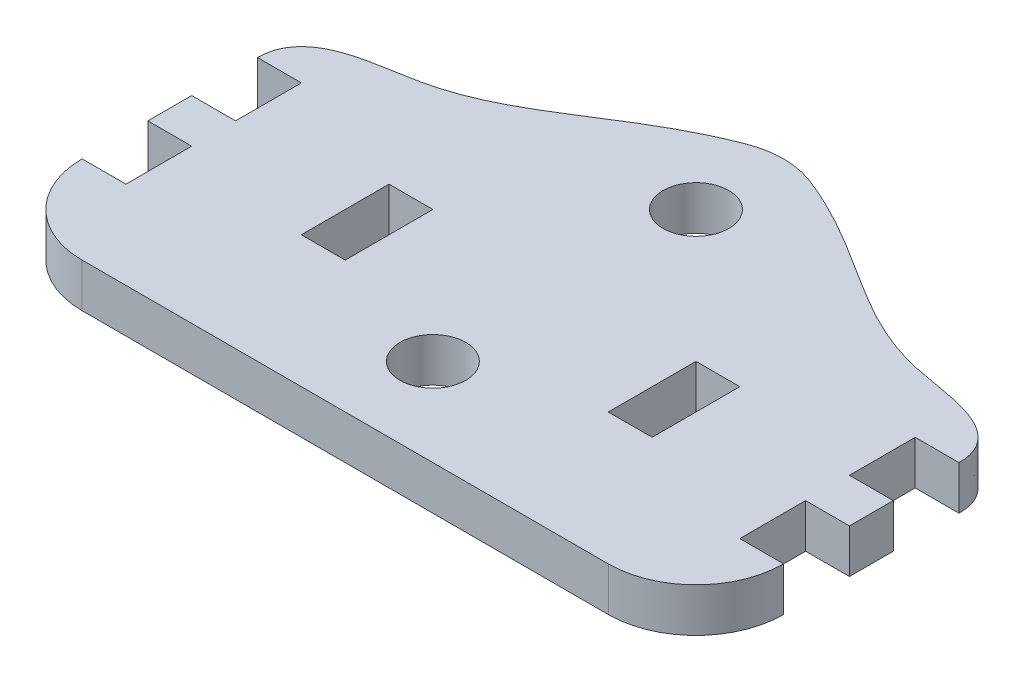
from build123d import *

# Parameters (mm, degrees)
SKETCH1_R           = 2.38125
BOSS_EXTRUDE1_DEPTH = 3.175
CAVITY1_START       = -9.525
CAVITY1_OUTLINE_W   = 3.175
CAVITY1_OUTLINE_H   = 3.175
CAVITY1_DEPTH       = 6.35


# Read off the part's stored shape, not the designer's step: Cavity1
with BuildPart() as part:
    # Sketch1 → Boss-Extrude1 (new body)
    # profile 1 of 4: a face of its own
    with BuildSketch(Plane(origin=(0, 0, 0), x_dir=(1, 0, 0), z_dir=(0, 1, 0))):
        with BuildLine():
            Line((-19.05, -6.35), (19.05, -6.35))
            ThreePointArc((19.05, -6.35), (23.540128061, -4.490128061), (25.4, 0))
            Line((25.4, 0), (22.225, 0))
            Line((22.225, 0), (22.225, 4.7625))
            Line((22.225, 4.7625), (25.4, 4.7625))
            Line((25.4, 4.7625), (25.4, 7.9375))
            Line((25.4, 7.9375), (22.225, 7.9375))
            Line((22.225, 7.9375), (22.225, 12.7))
            Line((22.225, 12.7), (0, 12.7))
            Line((0, 12.7), (-22.225, 12.7))
            Line((-22.225, 12.7), (-22.225, 7.9375))
            Line((-22.225, 7.9375), (-25.4, 7.9375))
            Line((-25.4, 7.9375), (-25.4, 4.7625))
            Line((-25.4, 4.7625), (-22.225, 4.7625))
            Line((-22.225, 4.7625), (-22.225, 0))
            Line((-22.225, 0), (-25.4, 0))
            ThreePointArc((-25.4, 0), (-23.540128061, -4.490128061), (-19.05, -6.35))
        make_face()
        with BuildLine():
            ThreePointArc((0, 2.38125), (1.683798023, 1.683798023), (2.38125, 0))
            ThreePointArc((2.38125, 0), (-1.683798023, -1.683798023), (0, 2.38125))
        make_face(mode=Mode.SUBTRACT)
    # profile 2 of 4: a face of its own
    with BuildSketch(Plane(origin=(0, 0, 0), x_dir=(1, 0, 0), z_dir=(0, 1, 0))):
        with BuildLine():
            Line((0, 12.7), (22.225, 12.7))
            Line((22.225, 12.7), (25.4, 12.7))
            add(Edge.make_bspline(
                [(25.4, 12.7), (25.4, 13.75902599), (23.890330765, 16.528390246), (16.188410672, 16.612194154), (9.505907267, 21.233154333), (4.692379923, 24.046890427), (2.283434696, 24.975236366)],
                knots=[0, 0, 0, 0, 0.091573424, 0.361911299, 0.725975428, 1, 1, 1, 1], degree=3))
            ThreePointArc((2.283434696, 24.975236366), (5.235566365, 22.643235984), (6.35, 19.05))
            ThreePointArc((6.35, 19.05), (4.490128061, 14.559871939), (0, 12.7))
        make_face()
    # profile 3 of 4: a face of its own
    with BuildSketch(Plane(origin=(0, 0, 0), x_dir=(1, 0, 0), z_dir=(0, 1, 0))):
        with BuildLine():
            Line((-25.4, 12.7), (-22.225, 12.7))
            Line((-22.225, 12.7), (0, 12.7))
            ThreePointArc((0, 12.7), (-6.242906011, 17.888697051), (-2.283434696, 24.975236366))
            add(Edge.make_bspline(
                [(-25.4, 12.7), (-25.4, 13.75902599), (-23.890330765, 16.528390246), (-16.188410672, 16.612194154), (-9.505907267, 21.233154333), (-4.692379923, 24.046890427), (-2.283434696, 24.975236366)],
                knots=[0, 0, 0, 0, 0.091573424, 0.361911299, 0.725975428, 1, 1, 1, 1], degree=3))
        make_face()
    # profile 4 of 4: a face of its own
    with BuildSketch(Plane(origin=(0, 0, 0), x_dir=(1, 0, 0), z_dir=(0, 1, 0))):
        with BuildLine():
            ThreePointArc((-2.283434696, 24.975236366), (-6.242906011, 17.888697051), (0, 12.7))
            ThreePointArc((0, 12.7), (4.490128061, 14.559871939), (6.35, 19.05))
            ThreePointArc((6.35, 19.05), (5.235566365, 22.643235984), (2.283434696, 24.975236366))
            ThreePointArc((2.283434696, 24.975236366), (0, 25.4), (-2.283434696, 24.975236366))
        make_face()
        with Locations(Location((0, 19.05, 0), (0, 0, 270))):
            Circle(SKETCH1_R, mode=Mode.SUBTRACT)
    extrude(amount=BOSS_EXTRUDE1_DEPTH)

    # Cavity1 outline → Cavity1 (cut)
    with BuildSketch(Plane.XY.offset(CAVITY1_START)):
        with Locations((11.1125, 1.5875)):
            Rectangle(CAVITY1_OUTLINE_W, CAVITY1_OUTLINE_H)
        with Locations((-11.1125, 1.5875)):
            Rectangle(CAVITY1_OUTLINE_W, CAVITY1_OUTLINE_H)
    extrude(amount=CAVITY1_DEPTH, mode=Mode.SUBTRACT)


solid = part.part
